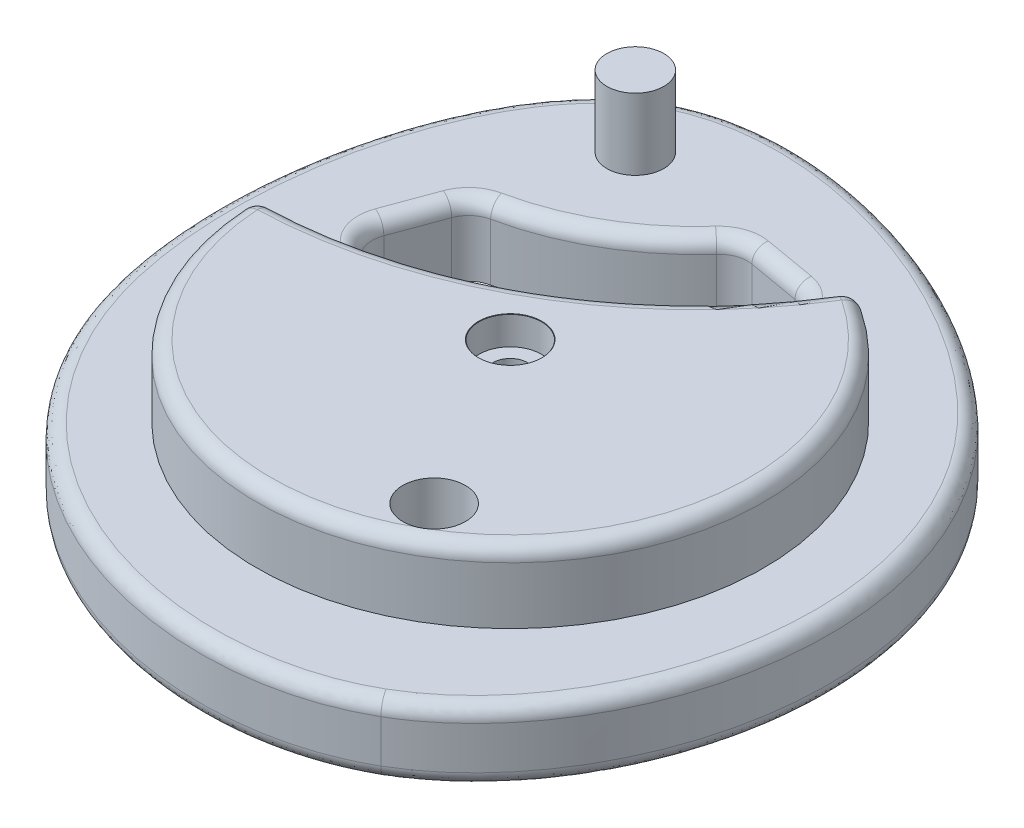
from build123d import *

# Parameters (mm, degrees)
BOSS_EXTRUDE1_DEPTH = 5
BOSS_EXTRUDE2_DEPTH = 5
SKETCH2_R           = 31
SKETCH2_R_2         = 2.2
CUT_EXTRUDE3_DEPTH  = 86.451740766
CUT_EXTRUDE4_DEPTH  = 77.707452169
FILLET1_R           = 2
SKETCH4_R           = 4.5
CUT_EXTRUDE7_DEPTH  = 4
FILLET2_R           = 1
FILLET4_R           = 1
FILLET5_R           = 1
FILLET6_R           = 1
CUT_EXTRUDE8_DEPTH  = 4
CUT_EXTRUDE9_DEPTH  = 3


with BuildPart() as part:
    # Sketch1 → Boss-Extrude1 (new body)
    with BuildSketch(Plane(origin=(0, 0, 0), x_dir=(1, 0, 0), z_dir=(0, 1, 0))):
        with BuildLine():
            ThreePointArc((65.8, 0), (48, -17.8), (30.2, 0))
            Line((30.2, 0), (17, 0))
            ThreePointArc((17, 0), (48, -31), (79, 0))
            ThreePointArc((79, 0), (63.5, 26.846787517), (32.5, 26.846787517))
            Line((32.5, 26.846787517), (35, 22.516660498))
            ThreePointArc((35, 22.516660498), (37, 22.516660498), (38, 20.784609691))
            ThreePointArc((38, 20.784609691), (37.732050808, 19.784609691), (37, 19.052558883))
            Line((37, 19.052558883), (39.1, 15.415252187))
            ThreePointArc((39.1, 15.415252187), (48, 17.8), (56.9, 15.415252187))
            ThreePointArc((56.9, 15.415252187), (63.415252187, 8.9), (65.8, 0))
        make_face()
        with BuildLine():
            ThreePointArc((45.615252187, 4.130504375), (38.179521702, 1.050523962), (30.2, 0))
            Line((30.2, 0), (48, 0))
            Line((48, 0), (45.615252187, 4.130504375))
        make_face()
        with BuildLine():
            ThreePointArc((39.1, 15.415252187), (32.584747813, 8.9), (30.2, 0))
            ThreePointArc((30.2, 0), (38.179521702, 1.050523962), (45.615252187, 4.130504375))
            Line((45.615252187, 4.130504375), (39.1, 15.415252187))
        make_face()
        with BuildLine():
            ThreePointArc((56.9, 15.415252187), (48, 17.8), (39.1, 15.415252187))
            Line((39.1, 15.415252187), (45.615252187, 4.130504375))
            ThreePointArc((45.615252187, 4.130504375), (52.000458711, 9.030045664), (56.9, 15.415252187))
        make_face()
        with BuildLine():
            Line((48, 0), (30.2, 0))
            ThreePointArc((30.2, 0), (48, -17.8), (65.8, 0))
            ThreePointArc((65.8, 0), (63.415252187, 8.9), (56.9, 15.415252187))
            ThreePointArc((56.9, 15.415252187), (52.000458711, 9.030045664), (45.615252187, 4.130504375))
            Line((45.615252187, 4.130504375), (48, 0))
        make_face()
        with BuildLine():
            Line((30.2, 17.43597813), (30.2, 0))
            ThreePointArc((30.2, 0), (32.584747813, 8.9), (39.1, 15.415252187))
            Line((39.1, 15.415252187), (37, 19.052558883))
            ThreePointArc((37, 19.052558883), (35.48236191, 18.852758038), (34.267949192, 19.784609691))
            Line((34.267949192, 19.784609691), (30.2, 17.43597813))
        make_face()
        with BuildLine():
            Line((17, 0), (30.2, 0))
            Line((30.2, 0), (30.2, 17.43597813))
            Line((30.2, 17.43597813), (19.007354532, 10.973901256))
            ThreePointArc((19.007354532, 10.973901256), (17.505967719, 5.577992044), (17, 0))
        make_face()
        with BuildLine():
            Line((19.007354532, 10.973901256), (30.2, 17.43597813))
            Line((30.2, 17.43597813), (30.2, 25.380307327))
            ThreePointArc((30.2, 25.380307327), (23.51992542, 19.019094315), (19.007354532, 10.973901256))
        make_face()
        with BuildLine():
            Line((30.2, 25.380307327), (30.2, 17.43597813))
            Line((30.2, 17.43597813), (34.267949192, 19.784609691))
            ThreePointArc((34.267949192, 19.784609691), (34.068148347, 21.302247781), (35, 22.516660498))
            Line((35, 22.516660498), (32.5, 26.846787517))
            ThreePointArc((32.5, 26.846787517), (31.333862444, 26.138857262), (30.2, 25.380307327))
        make_face()
        with BuildLine():
            Line((36, 20.784609691), (37, 19.052558883))
            ThreePointArc((37, 19.052558883), (37.732050808, 19.784609691), (38, 20.784609691))
            ThreePointArc((38, 20.784609691), (37, 22.516660498), (35, 22.516660498))
            Line((35, 22.516660498), (36, 20.784609691))
        make_face()
        with BuildLine():
            ThreePointArc((35, 22.516660498), (34.068148347, 21.302247781), (34.267949192, 19.784609691))
            Line((34.267949192, 19.784609691), (36, 20.784609691))
            Line((36, 20.784609691), (35, 22.516660498))
        make_face()
        with BuildLine():
            Line((36, 20.784609691), (34.267949192, 19.784609691))
            ThreePointArc((34.267949192, 19.784609691), (35.48236191, 18.852758038), (37, 19.052558883))
            Line((37, 19.052558883), (36, 20.784609691))
        make_face()
    extrude(amount=-BOSS_EXTRUDE1_DEPTH)

    # Sketch1<3> → Boss-Extrude2 (add)
    with BuildSketch(Plane(origin=(0, 0, 0), x_dir=(1, 0, 0), z_dir=(0, 1, 0))):
        with BuildLine():
            Line((36, 20.784609691), (37, 19.052558883))
            ThreePointArc((37, 19.052558883), (37.732050808, 19.784609691), (38, 20.784609691))
            ThreePointArc((38, 20.784609691), (37, 22.516660498), (35, 22.516660498))
            Line((35, 22.516660498), (36, 20.784609691))
        make_face()
        with BuildLine():
            ThreePointArc((35, 22.516660498), (34.068148347, 21.302247781), (34.267949192, 19.784609691))
            Line((34.267949192, 19.784609691), (36, 20.784609691))
            Line((36, 20.784609691), (35, 22.516660498))
        make_face()
        with BuildLine():
            Line((36, 20.784609691), (34.267949192, 19.784609691))
            ThreePointArc((34.267949192, 19.784609691), (35.48236191, 18.852758038), (37, 19.052558883))
            Line((37, 19.052558883), (36, 20.784609691))
        make_face()
        with BuildLine():
            Line((48, 0), (30.2, 0))
            ThreePointArc((30.2, 0), (48, -17.8), (65.8, 0))
            ThreePointArc((65.8, 0), (63.415252187, 8.9), (56.9, 15.415252187))
            ThreePointArc((56.9, 15.415252187), (52.000458711, 9.030045664), (45.615252187, 4.130504375))
            Line((45.615252187, 4.130504375), (48, 0))
        make_face()
        with BuildLine():
            ThreePointArc((45.615252187, 4.130504375), (38.179521702, 1.050523962), (30.2, 0))
            Line((30.2, 0), (48, 0))
            Line((48, 0), (45.615252187, 4.130504375))
        make_face()
    extrude(amount=BOSS_EXTRUDE2_DEPTH)

    # Sketch2 → Cut-Extrude3 (cut, through all)
    # profile 1 of 2: a face of its own
    with BuildSketch(Plane.XZ.offset(5)):
        with Locations((48, 0)):
            Circle(SKETCH2_R)
        with BuildLine():
            add(Edge.make_bspline(
                [(33.5, -25.11473671), (41.563395182, -29.770140089), (60.443335668, -23.447168333), (75.372368574, -0.370342159), (69.300289403, 16.338845531), (60.4, 21.477430014)],
                knots=[0, 0, 0, 0, 0.405972176, 0.488715181, 1, 1, 1, 1], degree=3))
            add(Edge.make_bspline(
                [(33.5, -25.11473671), (25.436604818, -20.459333331), (21.472488743, -0.947339371), (33.993089995, 23.519995467), (51.499710597, 26.616014497), (60.4, 21.477430014)],
                knots=[0, 0, 0, 0, 0.405972176, 0.488715181, 1, 1, 1, 1], degree=3))
        make_face(mode=Mode.SUBTRACT)
    # profile 2 of 2: a face of its own
    with BuildSketch(Plane.XZ.offset(5)):
        with Locations(Location((55.3, 12.643970895, 0), (0, 0, 270))):
            Circle(SKETCH2_R_2)
    extrude(amount=-CUT_EXTRUDE3_DEPTH, mode=Mode.SUBTRACT)

    # Sketch2<4> → Cut-Extrude4 (cut, through all)
    with BuildSketch(Plane.XZ.offset(5)):
        with BuildLine():
            ThreePointArc((44.768063231, -19.266269264), (39.5, -14.722431864), (32.930889766, -12.432073977))
            Line((32.930889766, -12.432073977), (30.2, -5))
            ThreePointArc((30.2, -5), (43.115252187, -8.460631394), (52.569872981, -17.915252187))
            Line((52.569872981, -17.915252187), (44.768063231, -19.266269264))
        make_face()
    extrude(amount=-CUT_EXTRUDE4_DEPTH, mode=Mode.SUBTRACT)

    # Fillet1
    fillet1_edges = [part.edges().sort_by_distance(p)[0] for p in [
        (44.768063231, -2.5, -19.266269264),
        (32.930889766, -2.5, -12.432073977),
        (30.2, -2.5, -5),
        (52.569872981, -2.5, -17.915252187),
    ]]
    fillet(fillet1_edges, radius=FILLET1_R)

    # Sketch4 → Cut-Extrude7 (cut)
    with BuildSketch(Plane.XZ.offset(5)):
        with Locations(Location((48, 0, 0), (0, 0, 270))):
            Circle(SKETCH4_R)
    extrude(amount=-CUT_EXTRUDE7_DEPTH, mode=Mode.SUBTRACT)

    # Fillet2
    fillet2_edges = [part.edges().sort_by_distance(p)[0] for p in [
        (56.9, 2.5, -15.415252187),
        (30.2, 2.5, 0),
    ]]
    fillet(fillet2_edges, radius=FILLET2_R)

    # Fillet4
    fillet4_edges = [part.edges().sort_by_distance(p)[0] for p in [
        (45.615252187, 5, -4.130504375),
        (56.9, 5, 15.415252187),
        (30.49030331, 5, 0.309117758),
        (57.022552176, 5, -15.009283267),
        (39.5, 0, -14.722431864),
        (31.895126128, 0, -9.613259363),
        (47.727110115, 0, -18.753859579),
        (43.115252187, 0, -8.460631394),
        (33.105473524, 0, -12.179552079),
        (44.899461731, 0, -18.988814345),
        (31.565785268, 0, -5.937525045),
        (51.075059842, 0, -17.201209972),
    ]]
    fillet(fillet4_edges, radius=FILLET4_R - 0.0001)  # a hair under: the kernel refuses the full size

    # Fillet5
    fillet5_edges = [part.edges().sort_by_distance(p)[0] for p in [
        (27.304835559, -5, 10.27793038),
        (67.248531028, -5, -12.783572951),
    ]]
    fillet(fillet5_edges, radius=FILLET5_R)

    # Fillet6
    fillet6_edges = [part.edges().sort_by_distance(p)[0] for p in [
        (27.304835555, 0, 10.277930382),
        (67.248531032, 0, -12.783572954),
    ]]
    fillet(fillet6_edges, radius=FILLET6_R)

    # Sketch7 → CBORE for M2 SHCS1 (revolve, cut)
    with BuildSketch(Plane(origin=(48, 5, 0), x_dir=(0, 0, 1), z_dir=(1, 0, 0))):
        Polygon((0, 0), (0, 15.721032743), (1.2, 15), (1.2, 2), (2.2, 2), (2.2, 0.025), (2.225, 0), align=None)
    revolve(axis=Axis((48, 11.35, 0), (0, -1, 0)), mode=Mode.SUBTRACT)

    # Sketch8 → Cut-Extrude8 (cut)
    with BuildSketch(Plane.XZ.offset(5)):
        Polygon((48.383974596, 2.665063509), (50.383974596, 6.129165125), (52.116025404, 5.129165125), (50.116025404, 1.665063509), align=None)
    extrude(amount=-CUT_EXTRUDE8_DEPTH, mode=Mode.SUBTRACT)

    # Sketch9 → Cut-Extrude9 (cut)
    with BuildSketch(Plane.XZ.offset(5)):
        Polygon((59.626345055, 12.824908635), (57.306475848, 16.481164488), (52.980130793, 16.300226748), (50.973654945, 12.463033155), (53.293524152, 8.806777302), (57.619869207, 8.987715042), align=None)
    extrude(amount=-CUT_EXTRUDE9_DEPTH, mode=Mode.SUBTRACT)


solid = part.part
